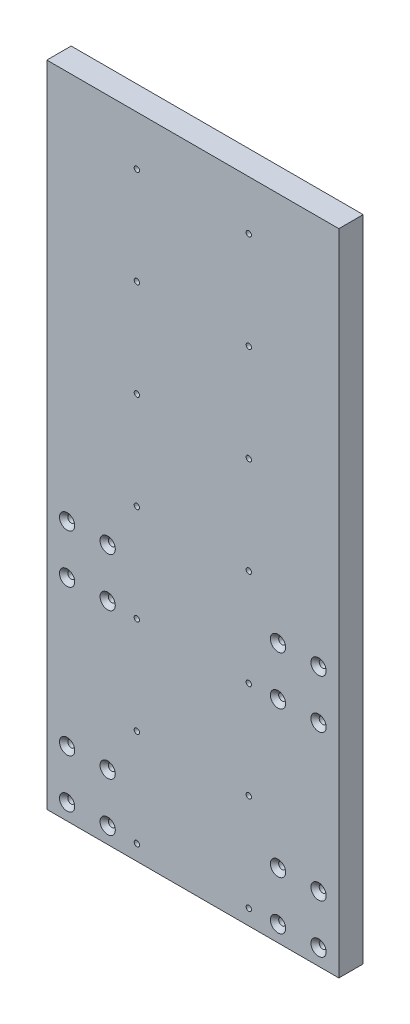
from build123d import *

# Parameters (mm, degrees)
SKETCH1_W                                       = 180
SKETCH1_H                                       = 400
BOSS_EXTRUDE1_DEPTH                             = 15
CSK_FOR_M4_FLAT_HEAD_MACHINE_SCREW1_D           = 4.3
CSK_FOR_M4_FLAT_HEAD_MACHINE_SCREW1_CSINK_D     = 9.4
CSK_FOR_M4_FLAT_HEAD_MACHINE_SCREW1_CSINK_ANGLE = 90
M4X0_7_TAPPED_HOLE1_D                           = 3.3


with BuildPart() as part:
    # Sketch1 → Boss-Extrude1 (new body)
    with BuildSketch(Plane.XY):
        Rectangle(SKETCH1_W, SKETCH1_H)
    extrude(amount=BOSS_EXTRUDE1_DEPTH)

    # CSK for M4 Flat Head Machine Screw1 (through all)
    with Locations(Plane.XY.offset(15)):
        with Locations((-77.5, -160), (-52.5, -160), (-52.5, -190), (-77.5, -190), (52.5, -160), (77.5, -160), (77.5, -190), (52.5, -190), (52.5, -40), (77.5, -40), (77.5, -70), (52.5, -70), (-77.5, -40), (-52.5, -40), (-52.5, -70), (-77.5, -70)):
            CounterSinkHole(CSK_FOR_M4_FLAT_HEAD_MACHINE_SCREW1_D / 2, CSK_FOR_M4_FLAT_HEAD_MACHINE_SCREW1_CSINK_D / 2, counter_sink_angle=CSK_FOR_M4_FLAT_HEAD_MACHINE_SCREW1_CSINK_ANGLE)

    # M4x0.7 Tapped Hole1 (through all)
    with Locations(Plane.XY.offset(15)):
        with Locations((-34.5, -190.5), (34.5, -190.5), (-34.5, -130.5), (34.5, -130.5), (-34.5, -70.5), (34.5, -70.5), (-34.5, -10.5), (34.5, -10.5), (-34.5, 49.5), (34.5, 49.5), (-34.5, 109.5), (34.5, 109.5), (-34.5, 169.5), (34.5, 169.5)):
            Hole(M4X0_7_TAPPED_HOLE1_D / 2)


solid = part.part
